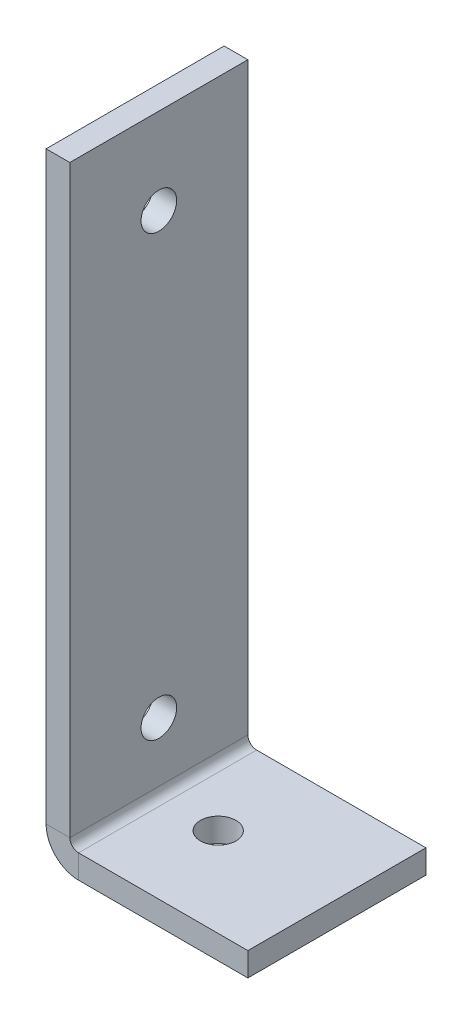
from build123d import *

# Parameters (mm, degrees)
SM_BASE_FLANGE_1_DEPTH = 15
SKETCH_6_R             = 1.5
CUT_EXTRUDE_1_DEPTH    = 55.313902456
SKETCH_7_R             = 1.5
CUT_EXTRUDE_2_DEPTH    = 55.313902456


# Sheet-metal steps are written as plain solids
with BuildPart() as part:
    # Sketch 1 → 基体-法兰1 (new body)
    with BuildSketch(Plane.XY):
        with BuildLine():
            Line((0, 50), (0, 0.7366))
            ThreePointArc((0, 0.7366), (0.215745145, 0.215745145), (0.7366, 0))
            Line((0.7366, 0), (15, 0))
            Line((15, 0), (15, -2))
            Line((15, -2), (0.7366, -2))
            ThreePointArc((0.7366, -2), (-1.198468417, -1.198468417), (-2, 0.7366))
            Line((-2, 0.7366), (-2, 50))
            Line((-2, 50), (0, 50))
        make_face()
    extrude(amount=SM_BASE_FLANGE_1_DEPTH)

    # 草图6 → 切除-拉伸1 (cut, through all)
    with BuildSketch(Plane(origin=(0, 0, 0), x_dir=(1, 0, 0), z_dir=(0, 1, 0))):
        with Locations(Location((5, -7.5, 0), (0, 0, 270))):
            Circle(SKETCH_6_R)
    extrude(amount=-CUT_EXTRUDE_1_DEPTH, mode=Mode.SUBTRACT)

    # 草图7 → 切除-拉伸2 (cut, through all)
    with BuildSketch(Plane(origin=(0, 0, 0), x_dir=(0, 0, -1), z_dir=(1, 0, 0))):
        with Locations(Location((-7.5, 42.7366, 0), (0, 0, 90))):
            Circle(SKETCH_7_R)
        with Locations(Location((-7.5, 5.7366, 0), (0, 0, 90))):
            Circle(SKETCH_7_R)
    extrude(amount=-CUT_EXTRUDE_2_DEPTH, mode=Mode.SUBTRACT)


solid = part.part
